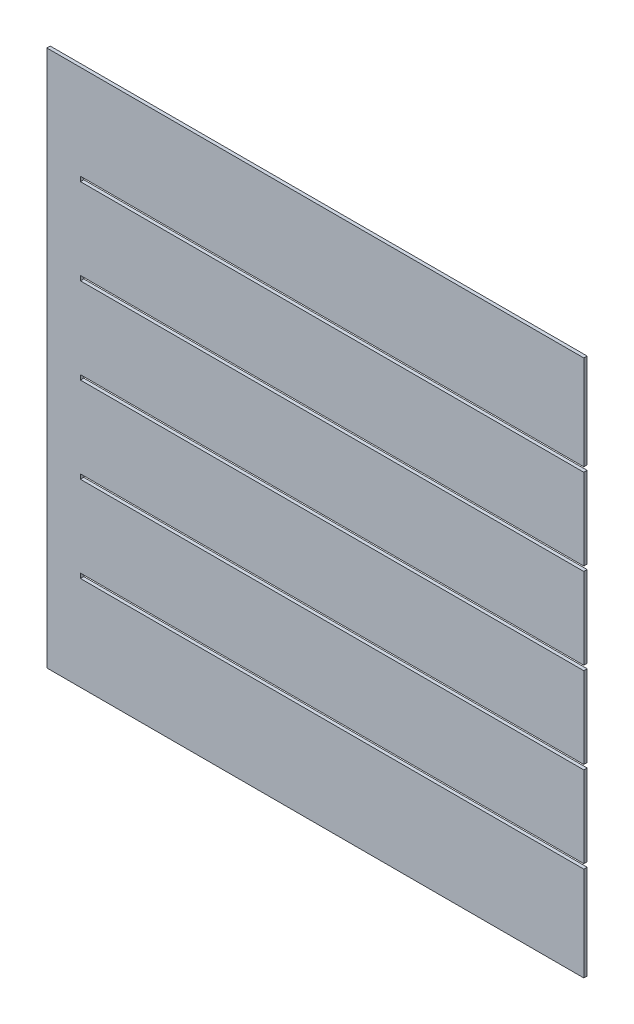
from build123d import *

# Parameters (mm, degrees)
EXTRUDE_1_DEPTH = 1


with BuildPart() as part:
    # 草图1 → 凸台-拉伸1 (new body)
    with BuildSketch(Plane.XY):
        Polygon((-75, 50.468617295), (-75, 51.868617295), (-65, 51.868617295), (75, 51.868617295), (75, 79.968617295), (-85, 79.968617295), (-85, -80.031382705), (75, -80.031382705), (75, -51.931382705), (-65, -51.931382705), (-75, -51.931382705), (-75, -50.531382705), (-65, -50.531382705), (75, -50.531382705), (75, -26.331382705), (-65, -26.331382705), (-75, -26.331382705), (-75, -24.931382705), (-65, -24.931382705), (75, -24.931382705), (75, -0.731382705), (-65, -0.731382705), (-75, -0.731382705), (-75, 0.668617295), (-65, 0.668617295), (75, 0.668617295), (75, 24.868617295), (-65, 24.868617295), (-75, 24.868617295), (-75, 26.268617295), (-65, 26.268617295), (75, 26.268617295), (75, 50.468617295), (-65, 50.468617295), align=None)
    extrude(amount=EXTRUDE_1_DEPTH)


solid = part.part
